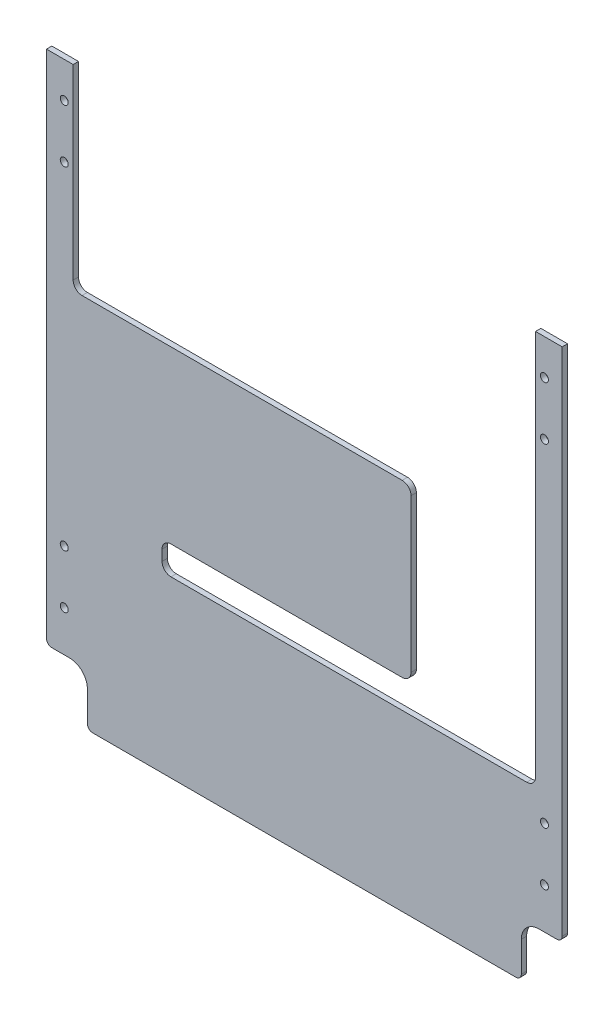
from build123d import *

# Parameters (mm, degrees)
ESQUISSE1_W                  = 290
ESQUISSE1_H                  = 320
BOSS_EXTRU_1_DEPTH           = 3
ENL_V_MAT_EXTRU_1_DEPTH      = 432.866877637
ENL_V_MAT_EXTRU_1_DEPTH_BACK = 432.866877637
ESQUISSE2_W                  = 23
ESQUISSE2_H                  = 30
CONG_1_R                     = 10
CONG_2_R                     = 3
ENL_V_MAT_EXTRU_2_DEPTH      = 432.866877637
ENL_V_MAT_EXTRU_2_DEPTH_BACK = 432.866877637
ESQUISSE3_W                  = 120
ESQUISSE3_H                  = 110
ENL_V_MAT_EXTRU_3_DEPTH      = 432.866877637
ENL_V_MAT_EXTRU_3_DEPTH_BACK = 432.866877637
ESQUISSE4_W                  = 70
ESQUISSE4_H                  = 222
ENL_V_MAT_EXTRU_4_DEPTH      = 432.866877637
ENL_V_MAT_EXTRU_4_DEPTH_BACK = 432.866877637
ESQUISSE5_W                  = 70
ESQUISSE5_H                  = 110
ENL_V_MAT_EXTRU_5_DEPTH      = 432.866877637
ENL_V_MAT_EXTRU_5_DEPTH_BACK = 432.866877637
ESQUISSE6_W                  = 140
ESQUISSE6_H                  = 16
CONG_3_R                     = 5
ENL_V_MAT_EXTRU_6_DEPTH      = 432.866877637
ENL_V_MAT_EXTRU_6_DEPTH_BACK = 432.866877637
ESQUISSE7_R                  = 2.25


with BuildPart() as part:
    # Esquisse1 → Boss.-Extru.1 (new body)
    with BuildSketch(Plane.XY):
        with Locations((145, 160)):
            Rectangle(ESQUISSE1_W, ESQUISSE1_H)
    extrude(amount=BOSS_EXTRU_1_DEPTH)

    # Esquisse2 → Enlèv. mat.-Extru.1 (cut, two sides: drawn at the far end of the back side and taken through both)
    with BuildSketch(Plane.XY.offset(3).offset(-ENL_V_MAT_EXTRU_1_DEPTH_BACK)):
        with Locations((278.5, 15)):
            Rectangle(ESQUISSE2_W, ESQUISSE2_H)
        with Locations((11.5, 15)):
            Rectangle(ESQUISSE2_W, ESQUISSE2_H)
    extrude(amount=ENL_V_MAT_EXTRU_1_DEPTH + ENL_V_MAT_EXTRU_1_DEPTH_BACK, mode=Mode.SUBTRACT)

    # Congé1
    cong_1_edges = [part.edges().sort_by_distance(p)[0] for p in [
        (267, 30, 1.5),
        (23, 30, 1.5),
    ]]
    fillet(cong_1_edges, radius=CONG_1_R)

    # Congé2
    cong_2_edges = [part.edges().sort_by_distance(p)[0] for p in [
        (290, 30, 1.5),
        (0, 30, 1.5),
        (23, 0, 1.5),
        (267, 0, 1.5),
    ]]
    fillet(cong_2_edges, radius=CONG_2_R)

    # Esquisse3 → Enlèv. mat.-Extru.2 (cut, two sides: drawn at the far end of the back side and taken through both)
    with BuildSketch(Plane.XY.offset(3).offset(-ENL_V_MAT_EXTRU_2_DEPTH_BACK)):
        with Locations((145, 265)):
            Rectangle(ESQUISSE3_W, ESQUISSE3_H)
    extrude(amount=ENL_V_MAT_EXTRU_2_DEPTH + ENL_V_MAT_EXTRU_2_DEPTH_BACK, mode=Mode.SUBTRACT)

    # Esquisse4 → Enlèv. mat.-Extru.3 (cut, two sides: drawn at the far end of the back side and taken through both)
    with BuildSketch(Plane.XY.offset(3).offset(-ENL_V_MAT_EXTRU_3_DEPTH_BACK)):
        with Locations((240, 209)):
            Rectangle(ESQUISSE4_W, ESQUISSE4_H)
    extrude(amount=ENL_V_MAT_EXTRU_3_DEPTH + ENL_V_MAT_EXTRU_3_DEPTH_BACK, mode=Mode.SUBTRACT)

    # Esquisse5 → Enlèv. mat.-Extru.4 (cut, two sides: drawn at the far end of the back side and taken through both)
    with BuildSketch(Plane.XY.offset(3).offset(-ENL_V_MAT_EXTRU_4_DEPTH_BACK)):
        with Locations((50, 265)):
            Rectangle(ESQUISSE5_W, ESQUISSE5_H)
    extrude(amount=ENL_V_MAT_EXTRU_4_DEPTH + ENL_V_MAT_EXTRU_4_DEPTH_BACK, mode=Mode.SUBTRACT)

    # Esquisse6 → Enlèv. mat.-Extru.5 (cut, two sides: drawn at the far end of the back side and taken through both)
    with BuildSketch(Plane.XY.offset(3).offset(-ENL_V_MAT_EXTRU_5_DEPTH_BACK)):
        with Locations((135, 106)):
            Rectangle(ESQUISSE6_W, ESQUISSE6_H)
    extrude(amount=ENL_V_MAT_EXTRU_5_DEPTH + ENL_V_MAT_EXTRU_5_DEPTH_BACK, mode=Mode.SUBTRACT)

    # Congé3
    cong_3_edges = [part.edges().sort_by_distance(p)[0] for p in [
        (275, 98, 1.5),
        (65, 98, 1.5),
        (65, 114, 1.5),
        (205, 114, 1.5),
        (205, 210, 1.5),
        (15, 210, 1.5),
    ]]
    fillet(cong_3_edges, radius=CONG_3_R)

    # Esquisse7 → Enlèv. mat.-Extru.6 (cut, two sides: drawn at the far end of the back side and taken through both)
    with BuildSketch(Plane.XY.offset(3).offset(-ENL_V_MAT_EXTRU_6_DEPTH_BACK)):
        with Locations((280, 300)):
            Circle(ESQUISSE7_R)
        with Locations((280, 270)):
            Circle(ESQUISSE7_R)
        with Locations((10, 270)):
            Circle(ESQUISSE7_R)
        with Locations((10, 300)):
            Circle(ESQUISSE7_R)
        with Locations((280, 83)):
            Circle(ESQUISSE7_R)
        with Locations((280, 53)):
            Circle(ESQUISSE7_R)
        with Locations((10, 53)):
            Circle(ESQUISSE7_R)
        with Locations((10, 83)):
            Circle(ESQUISSE7_R)
    extrude(amount=ENL_V_MAT_EXTRU_6_DEPTH + ENL_V_MAT_EXTRU_6_DEPTH_BACK, mode=Mode.SUBTRACT)


solid = part.part
